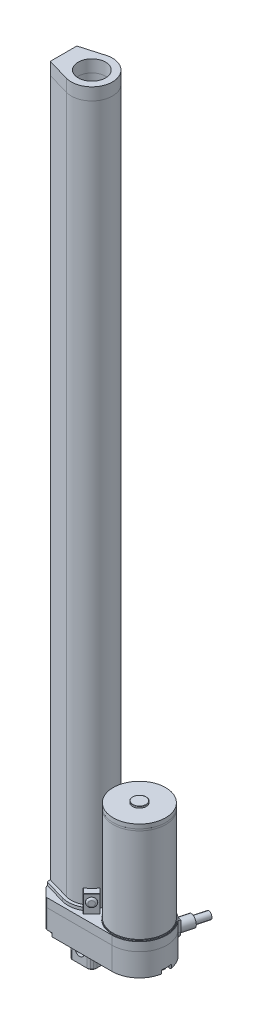
from build123d import *

# Parameters (mm, degrees)
BOSS_EXTRUDE1_DEPTH    = 6.35
SKETCH6_R              = 19.431
BOSS_EXTRUDE4_DEPTH    = 0.762
SKETCH7_R              = 19.05
BOSS_EXTRUDE5_DEPTH    = 68.326
FILLET6_R              = 5.08
FILLET7_R              = 1.905
BOSS_EXTRUDE15_DEPTH   = 6.35
SKETCH24_R             = 4.064
BOSS_EXTRUDE16_DEPTH   = 10.16
SKETCH25_R             = 2.54
BOSS_EXTRUDE17_DEPTH   = 10.16
BOSS_EXTRUDE19_DEPTH   = 16.51
FILLET13_R             = 1.905
FILLET14_R             = 5.08
BOSS_EXTRUDE20_DEPTH   = 18.796
CHAMFER1_SIZE          = 2.54
FILLET15_R             = 2.54
CHAMFER2_SIZE          = 0.762
SKETCH27_R             = 3.175
CUT_EXTRUDE3_DEPTH     = 19.05
SKETCH28_R             = 19.05
BOSS_EXTRUDE22_DEPTH   = 1.27
SKETCH29_R             = 19.05
BOSS_EXTRUDE24_DEPTH   = 3.048
BOSS_EXTRUDE25_START   = 4.318
SKETCH8_R              = 4.953
BOSS_EXTRUDE25_DEPTH   = 1.27
FILLET16_R             = 0.2286
BOSS_EXTRUDE26_DEPTH   = 508.381
SKETCH32_R             = 9.9695
BOSS_EXTRUDE27_DEPTH   = 8.89
BOSS_EXTRUDE30_DEPTH   = 2.159
BOSS_EXTRUDE31_DEPTH   = 2.159
BOSS_EXTRUDE33_DEPTH   = 12.7
BOSS_EXTRUDE33_2_DEPTH = 12.7
FILLET17_R             = 0.2286
FILLET18_R             = 0.2286
SKETCH43_R             = 3.175
BOSS_EXTRUDE34_DEPTH   = 1.27
FILLET19_R             = 1.27
SKETCH44_R             = 3.175
BOSS_EXTRUDE35_DEPTH   = 1.27
FILLET20_R             = 1.27
CUT_EXTRUDE5_START     = -2.54
CUT_EXTRUDE5_DEPTH     = 2.54
CUT_EXTRUDE6_START     = -2.54
CUT_EXTRUDE6_DEPTH     = 2.54
SKETCH47_R             = 2.54
BOSS_EXTRUDE36_DEPTH   = 2.54
BOSS_EXTRUDE36_2_DEPTH = 2.54
BOSS_EXTRUDE36_3_DEPTH = 2.54
FILLET22_R             = 1.524
FILLET23_R             = 1.524
SKETCH48_R             = 3.81
BOSS_EXTRUDE37_DEPTH   = 1.524
FILLET24_R             = 1.524
FILLET25_R             = 1.524
SKETCH49_R             = 3.81
CUT_EXTRUDE7_DEPTH     = 2.54
SKETCH50_R             = 3.556
BOSS_EXTRUDE39_DEPTH   = 2.54
SKETCH33_R             = 10.033
CUT_EXTRUDE8_DEPTH     = 488.95


with BuildPart() as part:
    # Sketch1 → Boss-Extrude1 (new body)
    with BuildSketch(Plane(origin=(0, 0, 0), x_dir=(1, 0, 0), z_dir=(0, 1, 0))):
        with BuildLine():
            Line((0, 32.639), (7.239, 39.878))
            Line((7.239, 39.878), (55.118, 39.878))
            ThreePointArc((55.118, 39.878), (75.057, 19.939), (55.118, 0))
            Line((55.118, 0), (7.239, 0))
            Line((7.239, 0), (0, 7.239))
            Line((0, 7.239), (0, 32.639))
        make_face()
    extrude(amount=BOSS_EXTRUDE1_DEPTH)

    # Fillet6
    fillet6_edges = [part.edges().sort_by_distance(p)[0] for p in [
        (0, 3.175, -7.239),
        (0, 3.175, -32.639),
    ]]
    fillet(fillet6_edges, radius=FILLET6_R)

    # Fillet7
    fillet7_edges = [part.edges().sort_by_distance(p)[0] for p in [
        (7.239, 3.175, 0),
        (7.239, 3.175, -39.878),
    ]]
    fillet(fillet7_edges, radius=FILLET7_R)


with BuildPart() as body_2:
    # Sketch6 → Boss-Extrude4 (new body)
    with BuildSketch(Plane(origin=(0, 6.35, 0), x_dir=(1, 0, 0), z_dir=(0, 1, 0))):
        with Locations(Location((55.118, 19.939, 0), (0, 0, 90))):
            Circle(SKETCH6_R)
    extrude(amount=BOSS_EXTRUDE4_DEPTH)


with BuildPart() as body_3:
    # Sketch7 → Boss-Extrude5 (new body)
    with BuildSketch(Plane(origin=(0, 7.112, 0), x_dir=(1, 0, 0), z_dir=(0, 1, 0))):
        with Locations(Location((55.118, 19.939, 0), (0, 0, 270))):
            Circle(SKETCH7_R)
    extrude(amount=BOSS_EXTRUDE5_DEPTH)


with BuildPart() as body_4:
    # Sketch23 → Boss-Extrude15 (new body)
    with BuildSketch(Plane(origin=(12.522748088, 0, -46.735532116), x_dir=(0, -1, 0), z_dir=(0.25881904510252135, 0, -0.9659258262890681))):
        with BuildLine():
            Line((-2.032, -53.883866243), (5.588, -53.883866243))
            ThreePointArc((5.588, -53.883866243), (11.303, -48.168866243), (5.588, -42.453866243))
            Line((5.588, -42.453866243), (-2.032, -42.453866243))
            Line((-2.032, -42.453866243), (-2.032, -53.883866243))
        make_face()
    extrude(amount=BOSS_EXTRUDE15_DEPTH)

    # Sketch24 → Boss-Extrude16 (add)
    with BuildSketch(Plane(origin=(14.166249025, 0, -52.869161113), x_dir=(-0.9659258262890682, 0, -0.25881904510252135), z_dir=(0.2588190451025213, 0, -0.9659258262890681))):
        with Locations((-48.168866243, -5.588)):
            Circle(SKETCH24_R)
    extrude(amount=BOSS_EXTRUDE16_DEPTH)

    # Sketch25 → Boss-Extrude17 (add)
    with BuildSketch(Plane(origin=(16.795850523, 0, -62.682967508), x_dir=(-0.9659258262890681, 0, -0.25881904510252135), z_dir=(0.25881904510252135, 0, -0.9659258262890681))):
        with Locations((-48.168866243, -5.588)):
            Circle(SKETCH25_R)
    extrude(amount=BOSS_EXTRUDE17_DEPTH)


with BuildPart() as body_5:
    # Sketch1<3> → Boss-Extrude19 (new body)
    with BuildSketch(Plane(origin=(0, 0, 0), x_dir=(1, 0, 0), z_dir=(0, 1, 0))):
        with BuildLine():
            Line((0, 32.639), (7.239, 39.878))
            Line((7.239, 39.878), (55.118, 39.878))
            ThreePointArc((55.118, 39.878), (75.057, 19.939), (55.118, 0))
            Line((55.118, 0), (7.239, 0))
            Line((7.239, 0), (0, 7.239))
            Line((0, 7.239), (0, 32.639))
        make_face()
    extrude(amount=-BOSS_EXTRUDE19_DEPTH)

    # Fillet13
    fillet13_edges = [body_5.edges().sort_by_distance(p)[0] for p in [
        (7.239, -8.255, 0),
        (7.239, -8.255, -39.878),
    ]]
    fillet(fillet13_edges, radius=FILLET13_R)

    # Fillet14
    fillet14_edges = [body_5.edges().sort_by_distance(p)[0] for p in [
        (0, -8.255, -7.239),
        (0, -8.255, -32.639),
    ]]
    fillet(fillet14_edges, radius=FILLET14_R)

    # Sketch45 → Cut-Extrude5 (cut)
    with BuildSketch(Plane.XZ.offset(16.51).offset(CUT_EXTRUDE5_START)):
        with BuildLine():
            ThreePointArc((5.044290367, -35.978344089), (4.718699387, -36.549691761), (4.084467985, -36.723467985))
            Line((4.084467985, -36.723467985), (6.681038418, -39.320038418))
            ThreePointArc((6.681038418, -39.320038418), (7.299064898, -39.732990509), (8.028076836, -39.878))
            Line((8.028076836, -39.878), (11.393838428, -39.878))
            ThreePointArc((11.393838428, -39.878), (11.138454644, -39.419455597), (11.282110896, -38.914632134))
            ThreePointArc((11.282110896, -38.914632134), (10.476958507, -32.531164357), (5.044290367, -35.978344089))
        make_face()
        with BuildLine():
            ThreePointArc((11.282110896, -0.963367866), (11.138454644, -0.458544403), (11.393838428, 0))
            Line((11.393838428, 0), (8.028076836, 0))
            ThreePointArc((8.028076836, 0), (7.299064898, -0.145009491), (6.681038418, -0.557961582))
            Line((6.681038418, -0.557961582), (4.084467985, -3.154532015))
            ThreePointArc((4.084467985, -3.154532015), (4.718699387, -3.328308239), (5.044290367, -3.899655911))
            ThreePointArc((5.044290367, -3.899655911), (10.476958507, -7.346835643), (11.282110896, -0.963367866))
        make_face()
    extrude(amount=CUT_EXTRUDE5_DEPTH, mode=Mode.SUBTRACT)

    # Sketch45<3> → Cut-Extrude6 (cut)
    with BuildSketch(Plane.XZ.offset(16.51).offset(CUT_EXTRUDE6_START)):
        with BuildLine():
            Line((4.084467985, -36.723467985), (6.681038418, -39.320038418))
            ThreePointArc((6.681038418, -39.320038418), (7.299064898, -39.732990509), (8.028076836, -39.878))
            Line((8.028076836, -39.878), (11.393838428, -39.878))
            ThreePointArc((11.393838428, -39.878), (11.138454644, -39.419455597), (11.282110896, -38.914632134))
            ThreePointArc((11.282110896, -38.914632134), (10.476958507, -32.531164357), (5.044290367, -35.978344089))
            ThreePointArc((5.044290367, -35.978344089), (4.718699387, -36.549691761), (4.084467985, -36.723467985))
        make_face()
        with BuildLine():
            Line((11.393838428, 0), (8.028076836, 0))
            ThreePointArc((8.028076836, 0), (7.299064898, -0.145009491), (6.681038418, -0.557961582))
            Line((6.681038418, -0.557961582), (4.084467985, -3.154532015))
            ThreePointArc((4.084467985, -3.154532015), (4.718699387, -3.328308239), (5.044290367, -3.899655911))
            ThreePointArc((5.044290367, -3.899655911), (10.476958507, -7.346835643), (11.282110896, -0.963367866))
            ThreePointArc((11.282110896, -0.963367866), (11.138454644, -0.458544403), (11.393838428, 0))
        make_face()
        with BuildLine():
            ThreePointArc((73.662109712, -16.992248385), (67.437, -19.939), (73.662109712, -22.885751615))
            ThreePointArc((73.662109712, -22.885751615), (74.341584064, -23.041280193), (74.712069674, -23.631716426))
            ThreePointArc((74.712069674, -23.631716426), (75.057, -19.939), (74.712069674, -16.246283574))
            ThreePointArc((74.712069674, -16.246283574), (74.341584064, -16.836719807), (73.662109712, -16.992248385))
        make_face()
    extrude(amount=CUT_EXTRUDE6_DEPTH, mode=Mode.SUBTRACT)


with BuildPart() as body_6:
    # Sketch26 → Boss-Extrude20 (new body)
    with BuildSketch(Plane(origin=(0, -16.51, 0), x_dir=(-1, 0, 0), z_dir=(0, -1, 0))):
        Polygon((-20.574, 28.829), (-11.684, 28.829), (-11.684, 11.049), (-29.464, 11.049), (-29.464, 28.829), align=None)
    extrude(amount=BOSS_EXTRUDE20_DEPTH)

    # Chamfer1
    chamfer1_edges = [body_6.edges().sort_by_distance(p)[0] for p in [
        (11.684, -25.908, -11.049),
        (29.464, -25.908, -11.049),
        (29.464, -25.908, -28.829),
        (11.684, -25.908, -28.829),
    ]]
    chamfer(chamfer1_edges, length=CHAMFER1_SIZE)

    # Fillet15
    fillet15_edges = [body_6.edges().sort_by_distance(p)[0] for p in [
        (29.464, -25.908, -13.589),
        (29.464, -25.908, -26.289),
        (14.224, -25.908, -28.829),
        (26.924, -25.908, -28.829),
        (14.224, -25.908, -11.049),
        (26.924, -25.908, -11.049),
        (11.684, -25.908, -26.289),
        (11.684, -25.908, -13.589),
    ]]
    fillet(fillet15_edges, radius=FILLET15_R)

    # Chamfer2
    chamfer2_edges = [body_6.edges().sort_by_distance(p)[0] for p in [
        (11.684, -35.306, -19.939),
        (12.954, -35.306, -12.319),
        (20.574, -35.306, -28.829),
        (28.194, -35.306, -27.559),
        (29.464, -35.306, -19.939),
        (28.194, -35.306, -12.319),
        (20.574, -35.306, -11.049),
        (12.954, -35.306, -27.559),
        (14.30408653, -35.306, -28.635654013),
        (11.877345987, -35.306, -26.20891347),
        (26.84391347, -35.306, -28.635654013),
        (29.270654013, -35.306, -26.20891347),
        (29.270654013, -35.306, -13.66908653),
        (26.84391347, -35.306, -11.242345987),
        (14.30408653, -35.306, -11.242345987),
        (11.877345987, -35.306, -13.66908653),
    ]]
    chamfer(chamfer2_edges, length=CHAMFER2_SIZE)

    # Sketch27 → Cut-Extrude3 (cut)
    with BuildSketch(Plane.XY.offset(-11.049)):
        with Locations((20.574, -26.67)):
            Circle(SKETCH27_R)
    extrude(amount=-CUT_EXTRUDE3_DEPTH, mode=Mode.SUBTRACT)


with BuildPart() as body_7:
    # Sketch28 → Boss-Extrude22 (new body)
    with BuildSketch(Plane(origin=(0, 75.438, 0), x_dir=(1, 0, 0), z_dir=(0, 1, 0))):
        with Locations(Location((55.118, 19.939, 0), (0, 0, 270))):
            Circle(SKETCH28_R)
    extrude(amount=BOSS_EXTRUDE22_DEPTH)


with BuildPart() as body_8:
    # Sketch29 → Boss-Extrude24 (new body)
    with BuildSketch(Plane(origin=(0, 76.708, 0), x_dir=(1, 0, 0), z_dir=(0, 1, 0))):
        with Locations(Location((55.118, 19.939, 0), (0, 0, 90))):
            Circle(SKETCH29_R)
    extrude(amount=BOSS_EXTRUDE24_DEPTH)

    # Sketch8 → Boss-Extrude25 (add)
    with BuildSketch(Plane(origin=(0, 75.438, 0), x_dir=(1, 0, 0), z_dir=(0, 1, 0)).offset(BOSS_EXTRUDE25_START)):
        with Locations(Location((55.118, 19.939, 0), (0, 0, 270))):
            Circle(SKETCH8_R)
    extrude(amount=BOSS_EXTRUDE25_DEPTH)

    # Fillet16
    fillet16_edges = [body_8.edges().sort_by_distance(p)[0] for p in [
        (55.118, 81.026, -24.892),
    ]]
    fillet(fillet16_edges, radius=FILLET16_R)


with BuildPart() as body_9:
    # Sketch15 → Boss-Extrude26 (new body)
    with BuildSketch(Plane(origin=(0, 6.35, 0), x_dir=(1, 0, 0), z_dir=(0, 1, 0))):
        with BuildLine():
            Line((0, 19.939), (0, 10.286870396))
            Line((0, 10.286870396), (16.411980417, 5.54225678))
            ThreePointArc((16.411980417, 5.54225678), (35.560281138, 19.939054609), (16.411875495, 34.335712887))
            Line((16.411875495, 34.335712887), (0, 29.591))
            Line((0, 29.591), (0, 19.939))
        make_face()
    extrude(amount=BOSS_EXTRUDE26_DEPTH)

    # Sketch48 → Boss-Extrude37 (add)
    with BuildSketch(Plane.ZY):
        with Locations(Location((-19.939, 12.7, 0), (0, 0, 180))):
            Circle(SKETCH48_R)
    extrude(amount=BOSS_EXTRUDE37_DEPTH)

    # Fillet24
    fillet24_edges = [body_9.edges().sort_by_distance(p)[0] for p in [
        (-1.524, 12.7, -16.129),
    ]]
    fillet(fillet24_edges, radius=FILLET24_R - 0.0001)  # a hair under: the kernel refuses the full size

    # Sketch49 → Cut-Extrude7 (cut)
    with BuildSketch(Plane.ZY):
        with Locations((-19.938935198, 509.778)):
            Circle(SKETCH49_R)
    extrude(amount=-CUT_EXTRUDE7_DEPTH, mode=Mode.SUBTRACT)

    # Sketch50 → Boss-Extrude39 (add)
    with BuildSketch(Plane.ZY.offset(-2.54)):
        with Locations((-19.938935198, 509.778)):
            Circle(SKETCH50_R)
    extrude(amount=BOSS_EXTRUDE39_DEPTH)

    # Sketch33 → Cut-Extrude8 (cut)
    with BuildSketch(Plane(origin=(0, 523.621, 0), x_dir=(1, 0, 0), z_dir=(0, 1, 0))):
        with Locations(Location((20.574, 19.939, 0), (0, 0, 270))):
            Circle(SKETCH33_R)
    extrude(amount=-CUT_EXTRUDE8_DEPTH, mode=Mode.SUBTRACT)


with BuildPart() as body_10:
    # Sketch32 → Boss-Extrude27 (new body)
    with BuildSketch(Plane(origin=(0, 514.731, 0), x_dir=(1, 0, 0), z_dir=(0, 1, 0))):
        with BuildLine():
            Line((0, 10.286870396), (0, 29.591))
            Line((0, 29.591), (16.411875495, 34.335712887))
            ThreePointArc((16.411875495, 34.335712887), (35.560281138, 19.939054609), (16.411980417, 5.54225678))
            Line((16.411980417, 5.54225678), (0, 10.286870396))
        make_face()
        with Locations(Location((20.574, 19.939, 0), (0, 0, 270))):
            Circle(SKETCH32_R, mode=Mode.SUBTRACT)
    extrude(amount=BOSS_EXTRUDE27_DEPTH)


with BuildPart() as body_11:
    # Sketch41 → Boss-Extrude30 (new body)
    with BuildSketch(Plane(origin=(0, 6.35, 0), x_dir=(1, 0, 0), z_dir=(0, 1, 0))):
        with BuildLine():
            Line((0, 29.591), (16.411875495, 34.335712887))
            ThreePointArc((16.411875495, 34.335712887), (22.021175201, 34.855243035), (27.425990452, 33.267122493))
            Line((27.425990452, 33.267122493), (29.11221422, 34.953346261))
            ThreePointArc((29.11221422, 34.953346261), (22.604273469, 37.091541659), (15.776987058, 36.531780434))
            Line((15.776987058, 36.531780434), (0.2736806, 32.049737053))
            Line((0.2736806, 32.049737053), (0, 30.534795103))
            Line((0, 30.534795103), (0, 29.591))
        make_face()
    extrude(amount=BOSS_EXTRUDE30_DEPTH)


with BuildPart() as body_12:
    # Sketch41<11> → Boss-Extrude31 (new body)
    with BuildSketch(Plane(origin=(0, 6.35, 0), x_dir=(1, 0, 0), z_dir=(0, 1, 0))):
        with BuildLine():
            Line((16.411875495, 5.542157508), (0, 10.286870396))
            Line((0, 10.286870396), (0, 9.343204897))
            Line((0, 9.343204897), (0, 9.343075292))
            Line((0, 9.343075292), (0.2736806, 7.828133343))
            Line((0.2736806, 7.828133343), (15.776987058, 3.346089961))
            ThreePointArc((15.776987058, 3.346089961), (22.604273469, 2.786328737), (29.11221422, 4.924524135))
            Line((29.11221422, 4.924524135), (27.425990452, 6.610747903))
            ThreePointArc((27.425990452, 6.610747903), (22.021175201, 5.02262736), (16.411875495, 5.542157508))
        make_face()
    extrude(amount=BOSS_EXTRUDE31_DEPTH)


with BuildPart() as body_13:
    # Sketch41<12> → Boss-Extrude33 (new body)
    with BuildSketch(Plane(origin=(0, 6.35, 0), x_dir=(1, 0, 0), z_dir=(0, 1, 0))):
        with BuildLine():
            Line((29.11221422, 34.953346261), (27.425990452, 33.267122493))
            ThreePointArc((27.425990452, 33.267122493), (31.070982239, 30.634886416), (33.77116823, 27.039941701))
            Line((33.77116823, 27.039941701), (37.542875801, 30.811649272))
            Line((37.542875801, 30.811649272), (31.256696516, 37.097828557))
            Line((31.256696516, 37.097828557), (29.11221422, 34.953346261))
        make_face()
    extrude(amount=BOSS_EXTRUDE33_DEPTH)

    # Fillet17
    fillet17_edges = [body_13.edges().sort_by_distance(p)[0] for p in [
        (35.657022016, 19.05, -28.925795487),
        (34.399786159, 19.05, -33.954738915),
        (29.341343484, 19.05, -35.182475525),
        (31.256696516, 12.7, -37.097828557),
        (37.542875801, 12.7, -30.811649272),
    ]]
    fillet(fillet17_edges, radius=FILLET17_R)


with BuildPart() as body_14:
    # Sketch41<12> → Boss-Extrude33 2 (new body)
    with BuildSketch(Plane(origin=(0, 6.35, 0), x_dir=(1, 0, 0), z_dir=(0, 1, 0))):
        with BuildLine():
            Line((31.256696516, 2.780041839), (37.542875801, 9.066221123))
            Line((37.542875801, 9.066221123), (33.77116823, 12.837928694))
            ThreePointArc((33.77116823, 12.837928694), (31.070982239, 9.24298398), (27.425990452, 6.610747903))
            Line((27.425990452, 6.610747903), (29.11221422, 4.924524135))
            Line((29.11221422, 4.924524135), (31.256696516, 2.780041839))
        make_face()
    extrude(amount=BOSS_EXTRUDE33_2_DEPTH)

    # Fillet18
    fillet18_edges = [body_14.edges().sort_by_distance(p)[0] for p in [
        (34.399786159, 19.05, -5.923131481),
        (35.657022016, 19.05, -10.952074909),
        (29.341343484, 19.05, -4.695394871),
        (37.542875801, 12.7, -9.066221123),
        (31.256696516, 12.7, -2.780041839),
    ]]
    fillet(fillet18_edges, radius=FILLET18_R)


with BuildPart() as body_15:
    # Sketch43 → Boss-Extrude34 (new body)
    with BuildSketch(Plane(origin=(34.177262537, 0, -34.177262537), x_dir=(-0.7071067811865481, 0, -0.7071067811865469), z_dir=(0.7071067811865469, 0, -0.7071067811865481))):
        with Locations(Location((-0.314695924, 13.7414, 0), (0, 0, 180))):
            Circle(SKETCH43_R)
    extrude(amount=BOSS_EXTRUDE34_DEPTH)

    # Fillet19
    fillet19_edges = [body_15.edges().sort_by_distance(p)[0] for p in [
        (33.052747741, 13.7414, -37.097828557),
    ]]
    fillet(fillet19_edges, radius=FILLET19_R - 0.0001)  # a hair under: the kernel refuses the full size


with BuildPart() as body_16:
    # Sketch44 → Boss-Extrude35 (new body)
    with BuildSketch(Plane(origin=(14.238327339, 0, 14.238327339), x_dir=(0.7071067811865481, 0, -0.7071067811865469), z_dir=(0.7071067811865469, 0, 0.7071067811865481))):
        with Locations(Location((28.5126085, 13.7414, 0), (0, 0, 180))):
            Circle(SKETCH44_R)
    extrude(amount=BOSS_EXTRUDE35_DEPTH)

    # Fillet20
    fillet20_edges = [body_16.edges().sort_by_distance(p)[0] for p in [
        (37.542875801, 13.7414, -7.270169899),
    ]]
    fillet(fillet20_edges, radius=FILLET20_R - 0.0001)  # a hair under: the kernel refuses the full size


with BuildPart() as body_17:
    # Sketch47 → Boss-Extrude36 (new body)
    with BuildSketch(Plane(origin=(0, -13.97, 0), x_dir=(-1, 0, 0), z_dir=(0, -1, 0))):
        with Locations(Location((-8.854290367, 35.978344089, 0), (0, 0, 90))):
            Circle(SKETCH47_R)
    extrude(amount=BOSS_EXTRUDE36_DEPTH)

    # Fillet22
    fillet22_edges = [body_17.edges().sort_by_distance(p)[0] for p in [
        (8.854290367, -16.51, -33.438344089),
    ]]
    fillet(fillet22_edges, radius=FILLET22_R)


with BuildPart() as body_18:
    # Sketch47 → Boss-Extrude36 2 (new body)
    with BuildSketch(Plane(origin=(0, -13.97, 0), x_dir=(-1, 0, 0), z_dir=(0, -1, 0))):
        with Locations(Location((-8.854290367, 3.899655911, 0), (0, 0, 90))):
            Circle(SKETCH47_R)
    extrude(amount=BOSS_EXTRUDE36_2_DEPTH)

    # Fillet23
    fillet23_edges = [body_18.edges().sort_by_distance(p)[0] for p in [
        (8.854290367, -16.51, -1.359655911),
    ]]
    fillet(fillet23_edges, radius=FILLET23_R)


with BuildPart() as body_19:
    # Sketch47 → Boss-Extrude36 3 (new body)
    with BuildSketch(Plane(origin=(0, -13.97, 0), x_dir=(-1, 0, 0), z_dir=(0, -1, 0))):
        with Locations(Location((-71.247, 19.939, 0), (0, 0, 90))):
            Circle(SKETCH47_R)
    extrude(amount=BOSS_EXTRUDE36_3_DEPTH)

    # Fillet25
    fillet25_edges = [body_19.edges().sort_by_distance(p)[0] for p in [
        (71.247, -16.51, -17.399),
    ]]
    fillet(fillet25_edges, radius=FILLET25_R)


solid = Compound([part.part, body_2.part, body_3.part, body_4.part, body_5.part, body_6.part, body_7.part, body_8.part, body_9.part, body_10.part, body_11.part, body_12.part, body_13.part, body_14.part, body_15.part, body_16.part, body_17.part, body_18.part, body_19.part])
